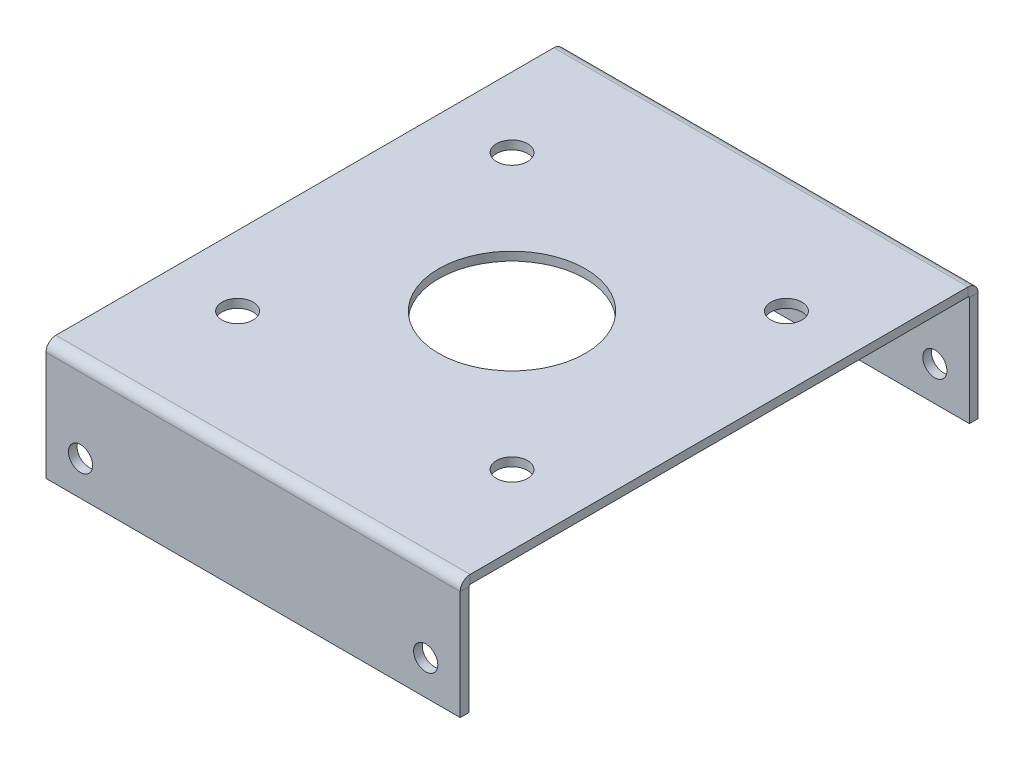
from build123d import *

# Parameters (mm, degrees)
SKETCH1_W                      = 240
SKETCH1_H                      = 300
BASE_FLANGE1_DEPTH             = 5
EDGE_FLANGE1_STRIP_W           = 21.4732
EDGE_FLANGE1_STRIP_H           = 5
EDGE_FLANGE1_STRIP_CUT_DEPTH   = 240
EDGE_FLANGE1_STRIP_2_W         = 21.4732
EDGE_FLANGE1_STRIP_2_H         = 5
EDGE_FLANGE1_STRIP_CUT_2_DEPTH = 240
EDGE_FLANGE1_DEPTH             = 240
EDGE_FLANGE1_BEND_DEPTH        = 240
CUT_EXTRUDE1_DEPTH             = 331.395217883
CUT_EXTRUDE1_DEPTH_BACK        = 331.395217883
SKETCH12_R                     = 7
SKETCH13_R                     = 42.5
SKETCH13_R_2                   = 9
CUT_EXTRUDE3_DEPTH             = 10


# Sheet-metal steps are written as plain solids
with BuildPart() as part:
    # Sketch1 → Base-Flange1 (new body)
    with BuildSketch(Plane(origin=(0, 0, 0), x_dir=(1, 0, 0), z_dir=(0, 1, 0))):
        Rectangle(SKETCH1_W, SKETCH1_H)
    extrude(amount=-BASE_FLANGE1_DEPTH)

    # Edge-Flange1 strip (across the edge) → Edge-Flange1 strip cut (cut)
    with BuildSketch(Plane(origin=(-120, -5, -150), x_dir=(0, 0, 1), z_dir=(1, 0, 0))):
        with Locations((-5, -2.5)):
            Rectangle(EDGE_FLANGE1_STRIP_W, EDGE_FLANGE1_STRIP_H)
    extrude(amount=EDGE_FLANGE1_STRIP_CUT_DEPTH, mode=Mode.SUBTRACT)

    # Edge-Flange1 strip 2 (across the edge) → Edge-Flange1 strip cut 2 (cut)
    with BuildSketch(Plane(origin=(120, -5, 150), x_dir=(0, 0, -1), z_dir=(-1, 0, 0))):
        with Locations((-5, -2.5)):
            Rectangle(EDGE_FLANGE1_STRIP_2_W, EDGE_FLANGE1_STRIP_2_H)
    extrude(amount=EDGE_FLANGE1_STRIP_CUT_2_DEPTH, mode=Mode.SUBTRACT)

    # Edge-Flange1 section (across the edge) → Edge-Flange1 (add)
    with BuildSketch(Plane(origin=(-120, -5, -150), x_dir=(0, 0, 1), z_dir=(1, 0, 0))):
        with BuildLine():
            Line((0, 0.7366), (0, 64))
            Line((0, 64), (5, 64))
            Line((5, 64), (5, 0.7366))
            ThreePointArc((5, 0.7366), (5.215745145, 0.215745145), (5.7366, 0))
            Line((5.7366, 0), (5.7366, -5))
            ThreePointArc((5.7366, -5), (1.680211239, -3.319788761), (0, 0.7366))
        make_face()
    extrude(amount=EDGE_FLANGE1_DEPTH)

    # Edge-Flange1 section 2 (across the edge) → Edge-Flange1 bend (add)
    with BuildSketch(Plane(origin=(120, -5, 150), x_dir=(0, 0, -1), z_dir=(-1, 0, 0))):
        with BuildLine():
            Line((0, 0.7366), (0, 64))
            Line((0, 64), (5, 64))
            Line((5, 64), (5, 0.7366))
            ThreePointArc((5, 0.7366), (5.215745145, 0.215745145), (5.7366, 0))
            Line((5.7366, 0), (5.7366, -5))
            ThreePointArc((5.7366, -5), (1.680211239, -3.319788761), (0, 0.7366))
        make_face()
    extrude(amount=EDGE_FLANGE1_BEND_DEPTH)

    # Sketch12 → Cut-Extrude1 (cut, two sides: drawn at the far end of the back side and taken through both)
    with BuildSketch(Plane(origin=(0, 0, -150), x_dir=(-1, 0, 0), z_dir=(0, 0, -1)).offset(-CUT_EXTRUDE1_DEPTH_BACK)):
        with Locations(Location((100, -49, 0), (0, 0, 90))):
            Circle(SKETCH12_R)
        with Locations(Location((-100, -49, 0), (0, 0, 90))):
            Circle(SKETCH12_R)
    extrude(amount=CUT_EXTRUDE1_DEPTH + CUT_EXTRUDE1_DEPTH_BACK, mode=Mode.SUBTRACT)

    # Sketch13 → Cut-Extrude3 (cut)
    with BuildSketch(Plane(origin=(0, 0, 0), x_dir=(1, 0, 0), z_dir=(0, 1, 0))):
        with Locations(Location((0, 0, 0), (0, 0, 270))):
            Circle(SKETCH13_R)
        with Locations(Location((79.5, 79.5, 0), (0, 0, 270))):
            Circle(SKETCH13_R_2)
        with Locations(Location((-79.5, 79.5, 0), (0, 0, 270))):
            Circle(SKETCH13_R_2)
        with Locations(Location((-79.5, -79.5, 0), (0, 0, 270))):
            Circle(SKETCH13_R_2)
        with Locations(Location((79.5, -79.5, 0), (0, 0, 270))):
            Circle(SKETCH13_R_2)
    extrude(amount=-CUT_EXTRUDE3_DEPTH, mode=Mode.SUBTRACT)


solid = part.part
